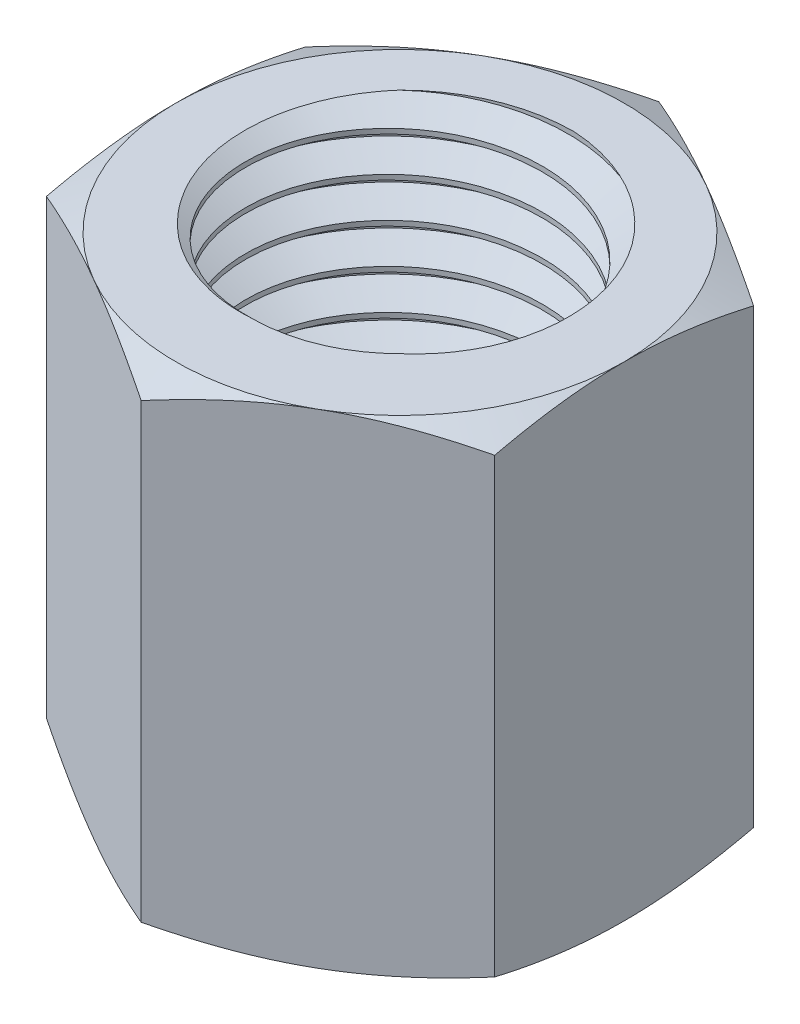
from build123d import *

# Parameters (mm, degrees)
EXTRUDE1_DEPTH   = 15.4305
SKETCH2_W        = 5.55625
SKETCH2_H        = 15.4305
CHAMFER1_SIZE    = 0.9525
CUT_SWEEP1_PITCH = 1.27
SKETCH7_W        = 5.55625
SKETCH7_H        = 2.57175
SKETCH8_W        = 3.937
SKETCH8_H        = 2.57175
FILLET1_R        = 0.381


with BuildPart() as part:
    # Sketch1 → Extrude1 (new body)
    with BuildSketch(Plane(origin=(0, 0, 0), x_dir=(1, 0, 0), z_dir=(0, 1, 0))):
        Polygon((0, 8.248891971), (-7.14375, 4.124445986), (-7.14375, -4.124445986), (0, -8.248891971), (7.14375, -4.124445986), (7.14375, 4.124445986), align=None)
    extrude(amount=EXTRUDE1_DEPTH)


with BuildPart() as body_2:
    # Sketch2 → Revolve1 (revolve)
    with BuildSketch(Plane(origin=(0, 0, 0), x_dir=(0, 0, -1), z_dir=(1, 0, 0))):
        with Locations((2.778125, 7.71525)):
            Rectangle(SKETCH2_W, SKETCH2_H)
    revolve(axis=Axis((0, -5.55625, 0), (0, 1, 0)))

    # Chamfer1
    chamfer1_edges = [body_2.edges().sort_by_distance(p)[0] for p in [
        (0, 0, 5.55625),
    ]]
    chamfer(chamfer1_edges, length=CHAMFER1_SIZE)

    # Cut-Sweep1: the profile of Sketch11 profile screwed along a right-hand helix of 40 turns, 8 arcs to a turn; built about Z, then put on its axis
    cut_sweep1_z = Axis((0, 0, 0), (0, 0, 1))
    cut_sweep1_corners = [(5.55655, 0, -1.111423205), (5.55655, 0, 0.000173205), (4.731360803, 0, -0.47625), (4.731360803, 0, -0.635)]
    with BuildLine(mode=Mode.PRIVATE) as cut_sweep1_profile:
        Line(cut_sweep1_corners[0], cut_sweep1_corners[1])
        Line(cut_sweep1_corners[1], cut_sweep1_corners[2])
        Line(cut_sweep1_corners[2], cut_sweep1_corners[3])
        Line(cut_sweep1_corners[3], cut_sweep1_corners[0])
    cut_sweep1_cap = Face(cut_sweep1_profile.wire())
    cut_sweep1_turn_angles = [0, 22.5, 45, 67.5, 90, 112.5, 135, 157.5, 180, 202.5, 225, 247.5, 270, 292.5, 315, 337.5, 360, 382.5, 405, 427.5, 450, 472.5, 495, 517.5, 540, 562.5, 585, 607.5, 630, 652.5, 675, 697.5, 720]
    cut_sweep1_turn_weights = [1, 0.9238795325112867, 1, 0.9238795325112867, 1, 0.9238795325112867, 1, 0.9238795325112867, 1, 0.9238795325112867, 1, 0.9238795325112867, 1, 0.9238795325112867, 1, 0.9238795325112867, 1, 0.9238795325112867, 1, 0.9238795325112867, 1, 0.9238795325112867, 1, 0.9238795325112867, 1, 0.9238795325112867, 1, 0.9238795325112867, 1, 0.9238795325112867, 1, 0.9238795325112867, 1]
    cut_sweep1_turn_rails = [Edge.make_bspline([Vector(p[0], p[1], 0).rotate(cut_sweep1_z, cut_sweep1_turn_angles[k]) / cut_sweep1_turn_weights[k] + Vector(0, 0, p[2] + CUT_SWEEP1_PITCH * cut_sweep1_turn_angles[k] / 360) for k in range(33)], [0, 0, 0, 1, 1, 2, 2, 3, 3, 4, 4, 5, 5, 6, 6, 7, 7, 8, 8, 9, 9, 10, 10, 11, 11, 12, 12, 13, 13, 14, 14, 15, 15, 16, 16, 16], 2, cut_sweep1_turn_weights) for p in cut_sweep1_corners]
    cut_sweep1_turn_sides = [Face.make_surface_from_curves(cut_sweep1_turn_rails[p[0]], cut_sweep1_turn_rails[p[1]]) for p in [(0, 1), (1, 2), (2, 3), (3, 0)]]
    cut_sweep1 = Plane(origin=(0, 15.4305, 0), x_dir=(0, 0, -1), z_dir=(0, -1, 0)) * Solid(Shell([*[p.moved(Location((0, 0, 2 * CUT_SWEEP1_PITCH * i))) for i in range(20) for p in cut_sweep1_turn_sides], cut_sweep1_cap, cut_sweep1_cap.rotate(cut_sweep1_z, 14400).moved(Location((0, 0, CUT_SWEEP1_PITCH * 14400 / 360)))]))
    add(cut_sweep1, mode=Mode.SUBTRACT)


with BuildPart() as part_1:
    add(part.part)

    # Combine1: cut body 2
    add(body_2.part, mode=Mode.SUBTRACT)

    # Sketch5 → Cut-Revolve3 (revolve, cut)
    with BuildSketch(Plane(origin=(0, 0, 0), x_dir=(0, 0, -1), z_dir=(1, 0, 0)), mode=Mode.PRIVATE) as cut_revolve3_sk:
        Polygon((0, 0), (7.14375, 0), (8.248891971, 0.515336164), (8.248891971, 14.915163836), (7.14375, 15.4305), (0, 15.4305), (0, 16.7005), (9.518891971, 16.7005), (9.518891971, -1.27), (0, -1.27), align=None)
    revolve(cut_revolve3_sk.sketch.rotate(Axis((0, 0, 0), (0, 1, 0)), 162.058762663), axis=Axis((0, 0, 0), (0, 1, 0)), mode=Mode.SUBTRACT)

    # Sketch7 → Revolve2 (revolve)
    with BuildSketch(Plane(origin=(0, 0, 0), x_dir=(0, 0, -1), z_dir=(1, 0, 0))):
        with Locations((2.778125, 1.285875)):
            Rectangle(SKETCH7_W, SKETCH7_H)
    revolve(axis=Axis((0, 0, 0), (0, 1, 0)))

    # Sketch8 → Cut-Revolve4 (revolve, cut)
    with BuildSketch(Plane(origin=(0, 0, 0), x_dir=(0, 0, -1), z_dir=(1, 0, 0))):
        with Locations((1.9685, 1.285875)):
            Rectangle(SKETCH8_W, SKETCH8_H)
    revolve(axis=Axis((0, 0, 0), (0, 1, 0)), mode=Mode.SUBTRACT)

    # Sketch9 → Revolve4 (revolve)
    with BuildSketch(Plane(origin=(0, 0, 0), x_dir=(0, 0, -1), z_dir=(1, 0, 0)), mode=Mode.PRIVATE) as revolve4_sk:
        Polygon((-3.81, 2.57175), (-3.81, -1.5875), (0, -1.5875), (0, 1.0033), (0, 1.787525), (-1.905, 1.787525), (-1.905, 4.66725), (-4.28625, 7.0485), (-5.55625, 7.0485), (-5.55625, 2.57175), align=None)
    revolve(revolve4_sk.sketch.rotate(Axis((0, 0, 0), (0, 1, 0)), 180), axis=Axis((0, 0, 0), (0, 1, 0)))

    # Fillet1
    fillet1_edges = [part_1.edges().sort_by_distance(p)[0] for p in [
        (0, -1.5875, 3.81),
    ]]
    fillet(fillet1_edges, radius=FILLET1_R)


solid = part_1.part
